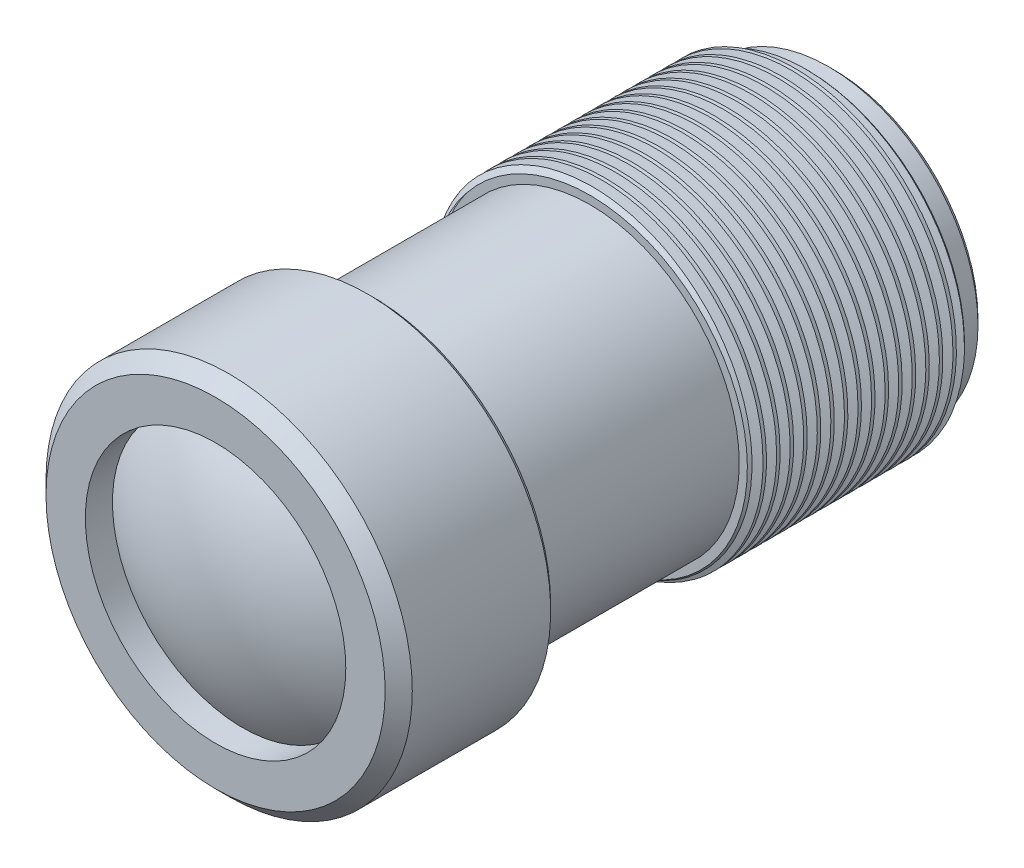
from build123d import *

# Parameters (mm, degrees)
SKETCH1_R           = 171.45
BOSS_EXTRUDE1_DEPTH = 579.12
SKETCH3_OUTSIDE_W   = 495.968
SKETCH3_OUTSIDE_H   = 495.968
SKETCH3_OUTSIDE_R   = 139.7
CUT_EXTRUDE1_DEPTH  = 203.2
SKETCH4_OUTSIDE_W   = 495.968
SKETCH4_OUTSIDE_H   = 495.968
SKETCH4_OUTSIDE_R   = 152.4
CUT_EXTRUDE3_DEPTH  = 228.6
SKETCH5_OUTSIDE_W   = 495.968
SKETCH5_OUTSIDE_H   = 495.968
SKETCH5_OUTSIDE_R   = 139.7
CUT_EXTRUDE4_DEPTH  = 25.4
SKETCH6_R           = 121.92
CUT_EXTRUDE5_DEPTH  = 25.4
SKETCH7_R           = 121.92
BOSS_EXTRUDE3_DEPTH = 2.54
CHAMFER1_SIZE       = 12.7
CHAMFER2_SIZE       = 5.08
CUT_SWEEP2_PITCH    = 12.7


# Read off the part's stored shape, not the designer's step: Dome1
with BuildPart() as part:
    # Sketch1 → Boss-Extrude1 (new body)
    with BuildSketch(Plane.XY):
        Circle(SKETCH1_R)
    extrude(amount=BOSS_EXTRUDE1_DEPTH)

    # Sketch3 outside → Cut-Extrude1 (cut)
    with BuildSketch(Plane(origin=(0, 0, 228.6), x_dir=(-1, 0, 0), z_dir=(0, 0, -1))):
        Rectangle(SKETCH3_OUTSIDE_W, SKETCH3_OUTSIDE_H)
        Circle(SKETCH3_OUTSIDE_R, mode=Mode.SUBTRACT)
    extrude(amount=-CUT_EXTRUDE1_DEPTH, mode=Mode.SUBTRACT)

    # Sketch4 outside → Cut-Extrude3 (cut)
    with BuildSketch(Plane.XY.offset(228.6)):
        Rectangle(SKETCH4_OUTSIDE_W, SKETCH4_OUTSIDE_H)
        Circle(SKETCH4_OUTSIDE_R, mode=Mode.SUBTRACT)
    extrude(amount=-CUT_EXTRUDE3_DEPTH, mode=Mode.SUBTRACT)

    # Sketch5 outside → Cut-Extrude4 (cut)
    with BuildSketch(Plane(origin=(0, 0, 0), x_dir=(-1, 0, 0), z_dir=(0, 0, -1))):
        Rectangle(SKETCH5_OUTSIDE_W, SKETCH5_OUTSIDE_H)
        Circle(SKETCH5_OUTSIDE_R, mode=Mode.SUBTRACT)
    extrude(amount=-CUT_EXTRUDE4_DEPTH, mode=Mode.SUBTRACT)

    # Sketch6 → Cut-Extrude5 (cut)
    with BuildSketch(Plane.XY.offset(579.12)):
        Circle(SKETCH6_R)
    extrude(amount=-CUT_EXTRUDE5_DEPTH, mode=Mode.SUBTRACT)

    # Chamfer1
    chamfer1_edges = [part.edges().sort_by_distance(p)[0] for p in [
        (-171.45, 0, 579.12),
    ]]
    chamfer(chamfer1_edges, length=CHAMFER1_SIZE)

    # Chamfer2
    chamfer2_edges = [part.edges().sort_by_distance(p)[0] for p in [
        (-152.4, 0, 228.6),
        (-152.4, 0, 25.4),
        (139.7, 0, 0),
        (-171.45, 0, 431.8),
    ]]
    chamfer(chamfer2_edges, length=CHAMFER2_SIZE)

    # Cut-Sweep2: the profile of Sketch10 screwed along a left-hand helix of 17 turns, 18 arcs to a turn; built about Z, then put on its axis
    cut_sweep2_z = Axis((0, 0, 0), (0, 0, 1))
    cut_sweep2_corners = [(158.078201225, 0.13559841, 10.223879238), (158.080360293, -0.069989486, -5.277082956), (143.513677878, 0.000352622, 0.026587037)]
    with BuildLine(mode=Mode.PRIVATE) as cut_sweep2_profile:
        Line(cut_sweep2_corners[0], cut_sweep2_corners[1])
        Line(cut_sweep2_corners[1], cut_sweep2_corners[2])
        Line(cut_sweep2_corners[2], cut_sweep2_corners[0])
    cut_sweep2_cap = Face(cut_sweep2_profile.wire())
    cut_sweep2_turn_angles = [0, -10, -20, -30, -40, -50, -60, -70, -80, -90, -100, -110, -120, -130, -140, -150, -160, -170, -180, -190, -200, -210, -220, -230, -240, -250, -260, -270, -280, -290, -300, -310, -320, -330, -340, -350, -360]
    cut_sweep2_turn_weights = [1, 0.984807753012208, 1, 0.984807753012208, 1, 0.984807753012208, 1, 0.984807753012208, 1, 0.984807753012208, 1, 0.984807753012208, 1, 0.984807753012208, 1, 0.984807753012208, 1, 0.984807753012208, 1, 0.984807753012208, 1, 0.984807753012208, 1, 0.984807753012208, 1, 0.984807753012208, 1, 0.984807753012208, 1, 0.984807753012208, 1, 0.984807753012208, 1, 0.984807753012208, 1, 0.984807753012208, 1]
    cut_sweep2_turn_rails = [Edge.make_bspline([Vector(p[0], p[1], 0).rotate(cut_sweep2_z, cut_sweep2_turn_angles[k]) / cut_sweep2_turn_weights[k] + Vector(0, 0, p[2] + -CUT_SWEEP2_PITCH * cut_sweep2_turn_angles[k] / 360) for k in range(37)], [0, 0, 0, 1, 1, 2, 2, 3, 3, 4, 4, 5, 5, 6, 6, 7, 7, 8, 8, 9, 9, 10, 10, 11, 11, 12, 12, 13, 13, 14, 14, 15, 15, 16, 16, 17, 17, 18, 18, 18], 2, cut_sweep2_turn_weights) for p in cut_sweep2_corners]
    cut_sweep2_turn_sides = [Face.make_surface_from_curves(cut_sweep2_turn_rails[p[0]], cut_sweep2_turn_rails[p[1]]) for p in [(0, 1), (1, 2), (2, 0)]]
    cut_sweep2 = Plane(origin=(0, 0, 25.4), x_dir=(-1, 0, 0), z_dir=(0, 0, 1)) * Solid(Shell([*[p.moved(Location((0, 0, CUT_SWEEP2_PITCH * i))) for i in range(17) for p in cut_sweep2_turn_sides], cut_sweep2_cap, cut_sweep2_cap.rotate(cut_sweep2_z, -6120).moved(Location((0, 0, -CUT_SWEEP2_PITCH * -6120 / 360)))]))
    add(cut_sweep2, mode=Mode.SUBTRACT)


with BuildPart() as body_2:
    # Sketch7 → Boss-Extrude3 (new body)
    with BuildSketch(Plane.XY.offset(553.72)):
        Circle(SKETCH7_R)
    extrude(amount=-BOSS_EXTRUDE3_DEPTH)

    # Dome1 outline → Dome1 (revolve)
    with BuildSketch(Plane.XZ):
        with BuildLine():
            Line((0, 553.72), (121.920000144, 553.7199999))
            ThreePointArc((121.920000144, 553.7199999), (63.867238164, 582.073161831), (0, 591.82))
            Line((0, 591.82), (0, 553.72))
        make_face()
    revolve(axis=Axis((0, 0, 0), (0, 0, 1)))


solid = Compound([part.part, body_2.part])
